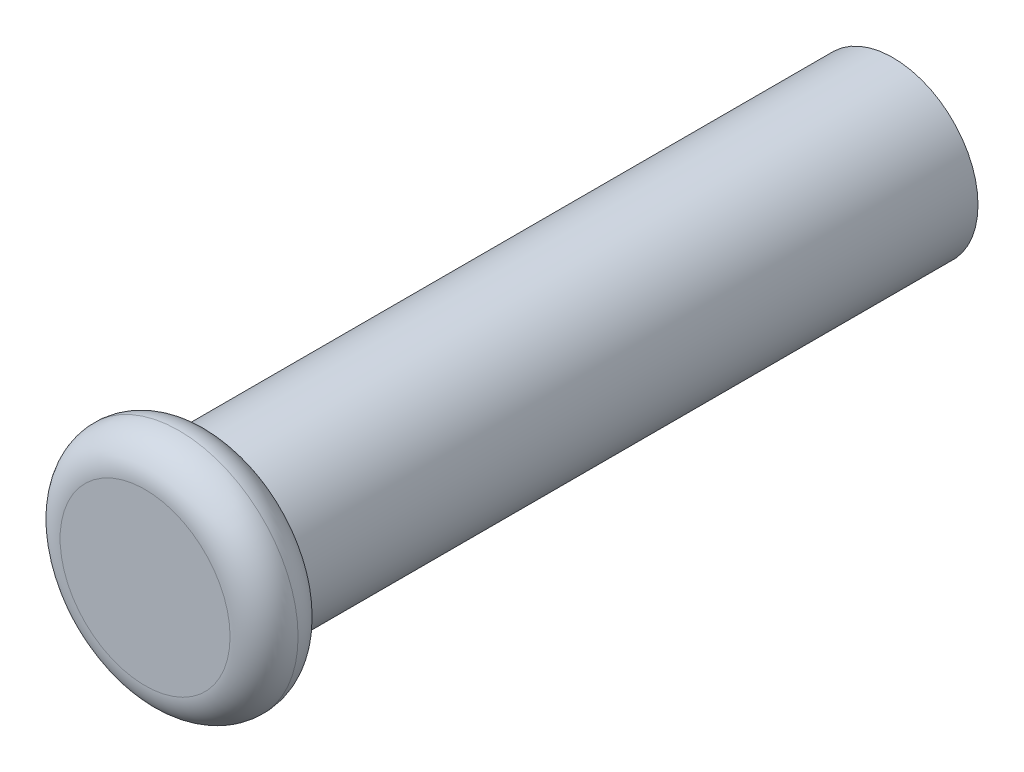
from build123d import *

# Parameters (mm, degrees)
SKETCH_1_R      = 2.5
EXTRUDE_1_DEPTH = 20
SKETCH_2_R      = 3.5
EXTRUDE_2_DEPTH = 2
FILLET_2_R      = 1


with BuildPart() as part:
    # 草图1 → 凸台-拉伸1 (new body)
    with BuildSketch(Plane.XY):
        Circle(SKETCH_1_R)
    extrude(amount=EXTRUDE_1_DEPTH)

    # 草图2 → 凸台-拉伸2 (add)
    with BuildSketch(Plane.XY.offset(20)):
        Circle(SKETCH_2_R)
    extrude(amount=EXTRUDE_2_DEPTH)

    # 圆角2
    fillet_2_edges = [part.edges().sort_by_distance(p)[0] for p in [
        (-3.5, 0, 20),
        (-3.5, 0, 22),
    ]]
    fillet(fillet_2_edges, radius=FILLET_2_R - 0.0001)  # a hair under: the kernel refuses the full size


solid = part.part
